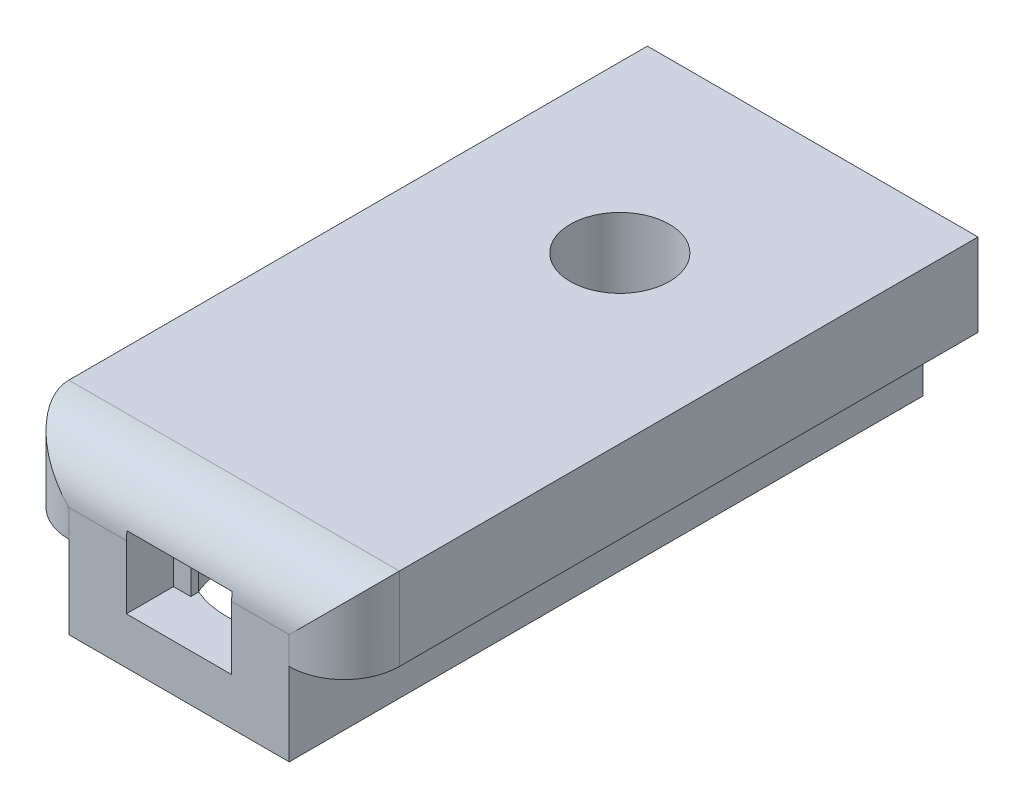
from build123d import *

# Parameters (mm, degrees)
SKETCH1_W           = 12
SKETCH1_H           = 23
BOSS_EXTRUDE1_DEPTH = 6
SKETCH2_W           = 2
SKETCH2_H           = 3
CUT_EXTRUDE1_DEPTH  = 25.515301344
SKETCH3_W           = 3.82
SKETCH3_H           = 2.6
CUT_EXTRUDE2_DEPTH  = 1.71
SKETCH4_W           = 2.566615902
SKETCH4_H           = 2.2
CUT_EXTRUDE3_DEPTH  = 3.1
CUT_EXTRUDE4_REACH  = 16.292
SKETCH5_R           = 3.265
FILLET1_R           = 2


with BuildPart() as part:
    # Sketch1 → Boss-Extrude1 (new body)
    with BuildSketch(Plane(origin=(0, 0, 0), x_dir=(1, 0, 0), z_dir=(0, 1, 0))):
        Rectangle(SKETCH1_W, SKETCH1_H)
    extrude(amount=BOSS_EXTRUDE1_DEPTH)

    # Sketch2 → Cut-Extrude1 (cut, through all)
    with BuildSketch(Plane.XY.offset(11.5)):
        with Locations((5, 1.5)):
            Rectangle(SKETCH2_W, SKETCH2_H)
        with Locations((-5, 1.5)):
            Rectangle(SKETCH2_W, SKETCH2_H)
    extrude(amount=-CUT_EXTRUDE1_DEPTH, mode=Mode.SUBTRACT)

    # Sketch3 → Cut-Extrude2 (cut)
    with BuildSketch(Plane.XY.offset(11.5)):
        with Locations((0, 3)):
            Rectangle(SKETCH3_W, SKETCH3_H)
    extrude(amount=-CUT_EXTRUDE2_DEPTH, mode=Mode.SUBTRACT)

    # Sketch4 → Cut-Extrude3 (cut)
    with BuildSketch(Plane.XY.offset(9.79)):
        with Locations((0, 2.8)):
            Rectangle(SKETCH4_W, SKETCH4_H)
    extrude(amount=-CUT_EXTRUDE3_DEPTH, mode=Mode.SUBTRACT)

    # Cut-Extrude4: up to this face of the body (flat: up to its plane)
    cut_extrude4_end = Plane(part.part.faces().sort_by_distance((0, 3.9, 8.24))[0])
    # Sketch5 → Cut-Extrude4 (cut, up to the picked face)
    with BuildSketch(Plane.XZ, mode=Mode.PRIVATE) as cut_extrude4_sk1:
        with Locations(Location((0, 6.5, 0), (0, 0, 270))):
            Circle(SKETCH5_R)
    cut_extrude4_tool1 = split(extrude(cut_extrude4_sk1.sketch, amount=-CUT_EXTRUDE4_REACH, mode=Mode.PRIVATE), bisect_by=cut_extrude4_end, keep=Keep.BOTH, mode=Mode.PRIVATE)
    add(cut_extrude4_tool1.solids().sort_by(Axis((0, 0, 6.5), (0, 1, 0)))[0], mode=Mode.SUBTRACT)

    # Fillet1
    # the kernel refuses this fillet: 2 mm, written as the material it takes off along each edge
    with BuildSketch(Plane(origin=(6, -2, 11.5), x_dir=(0, 0, -1), z_dir=(0, 1, 0))) as fillet1_piece_1:
        with BuildLine():
            CenterArc((FILLET1_R, FILLET1_R), FILLET1_R, 180, 90)
            Line((0, FILLET1_R), (0, 0))
            Line((0, 0), (FILLET1_R, 0))
        make_face()
    extrude(amount=13, mode=Mode.SUBTRACT)
    with BuildSketch(Plane(origin=(-11, 6, 11.5), x_dir=(0, 0, -1), z_dir=(1, 0, 0))) as fillet1_piece_2:
        with BuildLine():
            CenterArc((FILLET1_R, -FILLET1_R), FILLET1_R, 90, 90)
            Line((0, -FILLET1_R), (0, 0))
            Line((0, 0), (FILLET1_R, 0))
        make_face()
    extrude(amount=22, mode=Mode.SUBTRACT)
    with BuildSketch(Plane(origin=(-6, -2, 11.5), x_dir=(0, 0, -1), z_dir=(0, 1, 0))) as fillet1_piece_3:
        with BuildLine():
            CenterArc((FILLET1_R, -FILLET1_R), FILLET1_R, 90, 90)
            Line((0, -FILLET1_R), (0, 0))
            Line((0, 0), (FILLET1_R, 0))
        make_face()
    extrude(amount=13, mode=Mode.SUBTRACT)

    # Sketch7 → CSK SLOT for M1.6 Countersunk Flat Head Screw1 (revolve, cut)
    with BuildSketch(Plane(origin=(0, 6, -4.5), x_dir=(0, 0, 1), z_dir=(1, 0, 0))):
        Polygon((0, 0), (0, 6), (0.9, 6), (0.9, 4.9), (1.8, 4), (1.8, 0), align=None)
    revolve(axis=Axis((0, 12.35, -4.5), (0, -1, 0)), mode=Mode.SUBTRACT)


solid = part.part
